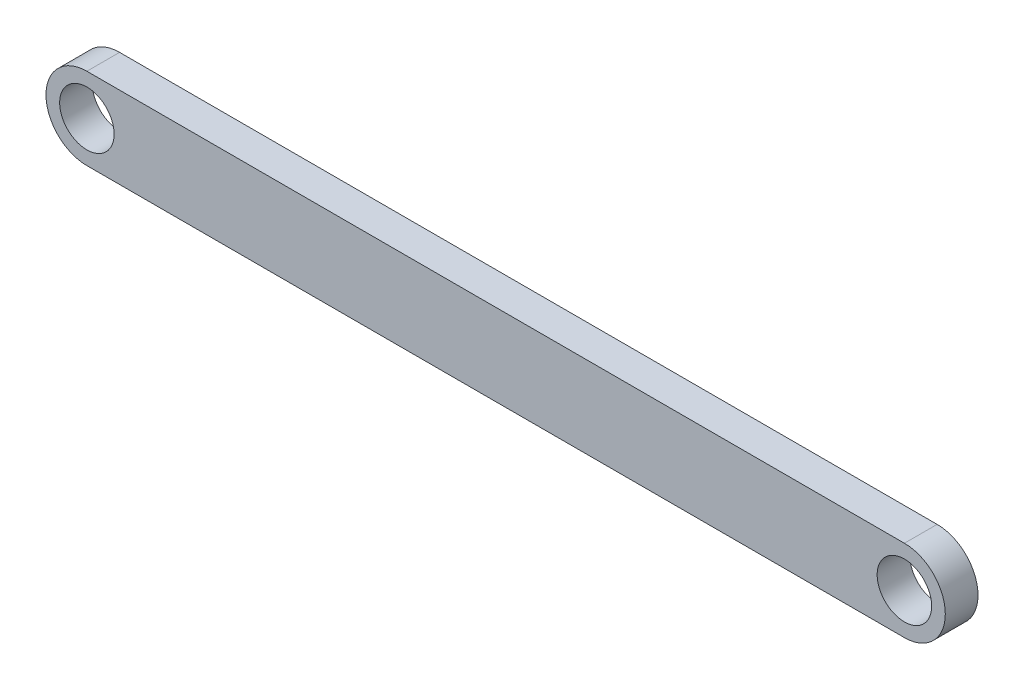
from build123d import *

# Parameters (mm, degrees)
SKETCH1_R           = 5
BOSS_EXTRUDE1_DEPTH = 6


with BuildPart() as part:
    # Sketch1 → Boss-Extrude1 (new body)
    with BuildSketch(Plane.XY):
        with BuildLine():
            Line((75, -7.5), (-75, -7.5))
            ThreePointArc((-75, -7.5), (-82.5, 0), (-75, 7.5))
            Line((-75, 7.5), (75, 7.5))
            ThreePointArc((75, 7.5), (82.5, 0), (75, -7.5))
        make_face()
        with Locations((75, 0)):
            Circle(SKETCH1_R, mode=Mode.SUBTRACT)
        with Locations((-75, 0)):
            Circle(SKETCH1_R, mode=Mode.SUBTRACT)
    extrude(amount=BOSS_EXTRUDE1_DEPTH)


solid = part.part
